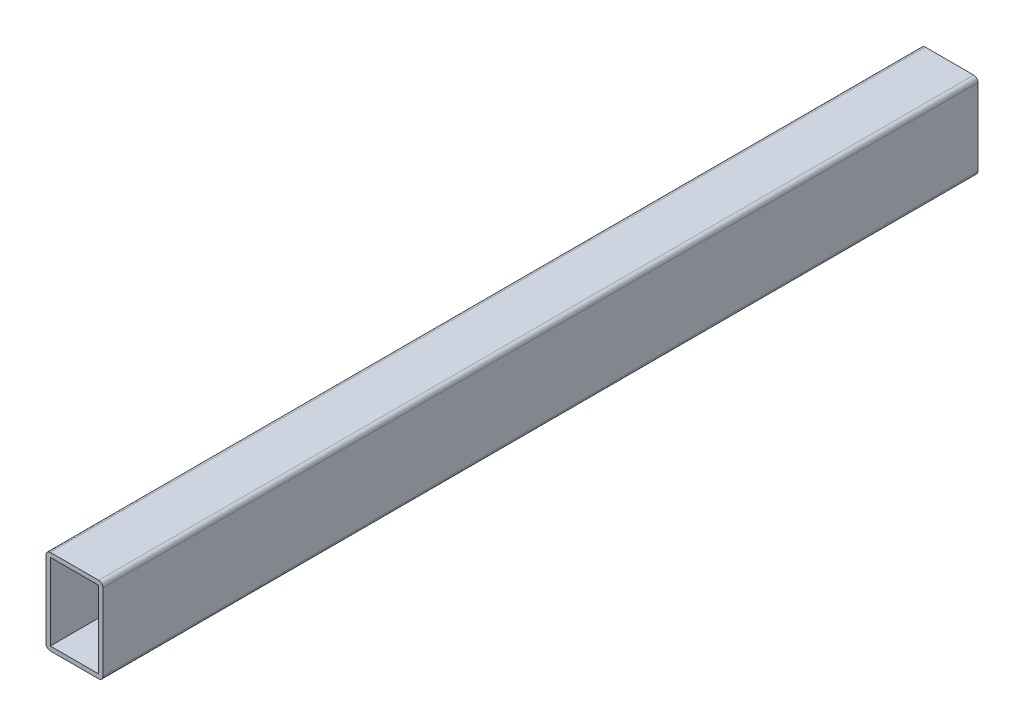
from build123d import *

# Parameters (mm, degrees)
SKETCH1_W           = 68
SKETCH1_H           = 108
BOSS_EXTRUDE1_DEPTH = 615


with BuildPart() as part:
    # Sketch1 → Boss-Extrude1 (new, symmetric)
    with BuildSketch(Plane.XY):
        with BuildLine():
            Line((34, -60), (-34, -60))
            ThreePointArc((-34, -60), (-38.242640687, -58.242640687), (-40, -54))
            Line((-40, -54), (-40, 54))
            ThreePointArc((-40, 54), (-38.242640687, 58.242640687), (-34, 60))
            Line((-34, 60), (34, 60))
            ThreePointArc((34, 60), (38.242640687, 58.242640687), (40, 54))
            Line((40, 54), (40, -54))
            ThreePointArc((40, -54), (38.242640687, -58.242640687), (34, -60))
        make_face()
        Rectangle(SKETCH1_W, SKETCH1_H, mode=Mode.SUBTRACT)
    extrude(amount=BOSS_EXTRUDE1_DEPTH, both=True)


solid = part.part
